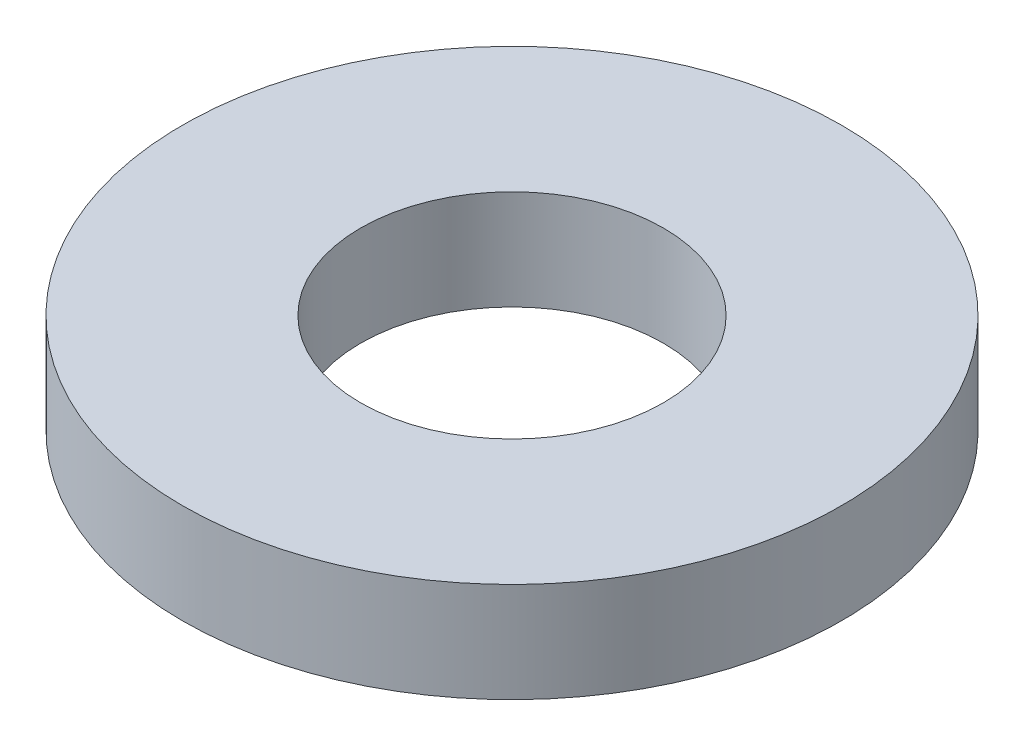
from build123d import *

# Parameters (mm, degrees)
SKETCH1_R           = 92.5
BOSS_EXTRUDE1_DEPTH = 28
SKETCH2_R           = 42.5
CUT_EXTRUDE1_DEPTH  = 134.777800849


with BuildPart() as part:
    # Sketch1 → Boss-Extrude1 (new body)
    with BuildSketch(Plane(origin=(0, 0, 0), x_dir=(1, 0, 0), z_dir=(0, 1, 0))):
        Circle(SKETCH1_R)
    extrude(amount=BOSS_EXTRUDE1_DEPTH)

    # Sketch2 → Cut-Extrude1 (cut, through all)
    with BuildSketch(Plane(origin=(0, 0, 0), x_dir=(1, 0, 0), z_dir=(0, 1, 0))):
        Circle(SKETCH2_R)
    extrude(amount=CUT_EXTRUDE1_DEPTH, mode=Mode.SUBTRACT)


solid = part.part
